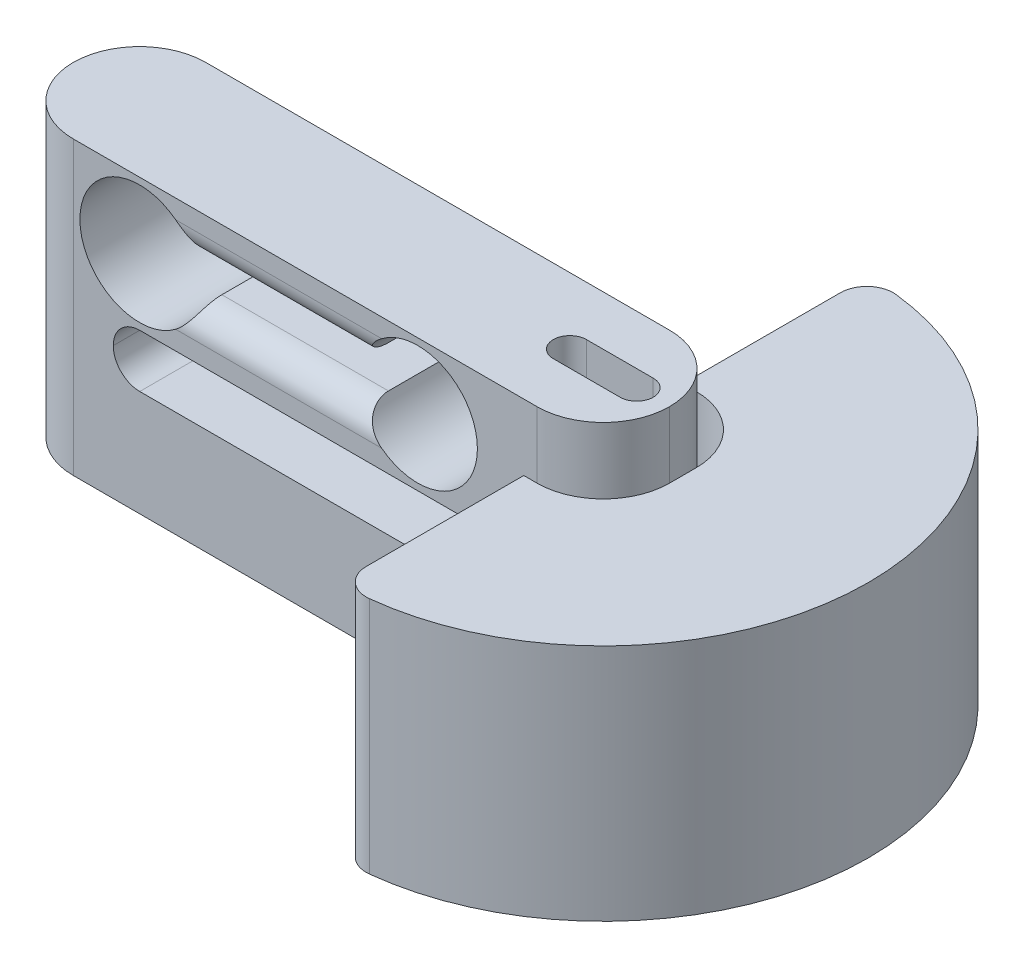
from build123d import *

# Parameters (mm, degrees)
BOSS_EXTRUDE1_DEPTH      = 5
BOSS_EXTRUDE1_DEPTH_BACK = 5
CUT_EXTRUDE1_DEPTH       = 5
BOSS_EXTRUDE2_START      = -14
SKETCH3_W                = 5.881583951
SKETCH3_H                = 10
BOSS_EXTRUDE2_DEPTH      = 8
BOSS_EXTRUDE3_START      = 10
BOSS_EXTRUDE3_DEPTH      = 10
FILLET2_R                = 5
FILLET3_R                = 2
SKETCH5_R                = 2
SKETCH5_W                = 3
SKETCH5_H                = 3
CUT_EXTRUDE2_DEPTH       = 4
FILLET4_R                = 1
SKETCH6_R                = 3.25
CUT_EXTRUDE3_DEPTH       = 5
BOSS_EXTRUDE4_START      = -14
SKETCH7_R                = 2
BOSS_EXTRUDE4_DEPTH      = 3.7
FILLET5_R                = 1.6


with BuildPart() as part:
    # Sketch1 → Boss-Extrude1 (new, two sides: drawn at the far end of the back side and taken through both)
    with BuildSketch(Plane.XY.offset(-BOSS_EXTRUDE1_DEPTH_BACK)):
        Polygon((5, -10), (5, 0), (0, 0), (-5, 0), (-35, 0), (-40, 0), (-40, -14), (-31.982625312, -14), (-31.982625312, -10), (-5, -10), align=None)
        with BuildLine():
            ThreePointArc((-25.78623506, -6.579298906), (-34.5, -5), (-25.78623506, -3.420701094))
            Line((-25.78623506, -3.420701094), (-13.21376494, -3.420701094))
            ThreePointArc((-13.21376494, -3.420701094), (-8.197485897, -0.572136959), (-4.5, -5))
            ThreePointArc((-4.5, -5), (-8.197485897, -9.427863041), (-13.21376494, -6.579298906))
            Line((-13.21376494, -6.579298906), (-25.78623506, -6.579298906))
        make_face(mode=Mode.SUBTRACT)
    extrude(amount=BOSS_EXTRUDE1_DEPTH + BOSS_EXTRUDE1_DEPTH_BACK)

    # Sketch2 → Cut-Extrude1 (cut)
    with BuildSketch(Plane(origin=(0, 0, 0), x_dir=(1, 0, 0), z_dir=(0, 1, 0))):
        with BuildLine():
            Line((-2.520975228, 1.25), (2.520975228, 1.25))
            ThreePointArc((2.520975228, 1.25), (3.770975228, 0), (2.520975228, -1.25))
            Line((2.520975228, -1.25), (-2.520975228, -1.25))
            ThreePointArc((-2.520975228, -1.25), (-3.770975228, 0), (-2.520975228, 1.25))
        make_face()
    extrude(amount=-CUT_EXTRUDE1_DEPTH, mode=Mode.SUBTRACT)

    # Sketch3 → Boss-Extrude2 (add)
    with BuildSketch(Plane(origin=(0, 0, 0), x_dir=(1, 0, 0), z_dir=(0, 1, 0)).offset(BOSS_EXTRUDE2_START)):
        with BuildLine():
            Line((0, 20), (0, 5))
            Line((0, 5), (5.881583951, 5))
            Line((5.881583951, 5), (5.881583951, -5))
            Line((5.881583951, -5), (0, -5))
            Line((0, -5), (0, -20))
            ThreePointArc((0, -20), (14.142135624, -14.142135624), (20, 0))
            ThreePointArc((20, 0), (14.142135624, 14.142135624), (0, 20))
        make_face()
        with Locations((2.940791976, 0)):
            Rectangle(SKETCH3_W, SKETCH3_H)
        with BuildLine():
            Line((0, 5), (-19.364916731, 5))
            ThreePointArc((-19.364916731, 5), (-20, 0), (-19.364916731, -5))
            Line((-19.364916731, -5), (0, -5))
            Line((0, -5), (0, 5))
        make_face()
        with BuildLine():
            Line((-19.364916731, 5), (-40, 5))
            Line((-40, 5), (-40, -5))
            Line((-40, -5), (-19.364916731, -5))
            ThreePointArc((-19.364916731, -5), (-20, 0), (-19.364916731, 5))
        make_face()
    extrude(amount=-BOSS_EXTRUDE2_DEPTH)

    # Sketch4 → Boss-Extrude3 (add)
    with BuildSketch(Plane(origin=(0, -14, 0), x_dir=(1, 0, 0), z_dir=(0, 1, 0)).offset(BOSS_EXTRUDE3_START)):
        with BuildLine():
            ThreePointArc((20, 0), (14.142135624, 14.142135624), (0, 20))
            Line((0, 20), (0, 6))
            Line((0, 6), (6, 6))
            Line((6, 6), (6, -6))
            Line((6, -6), (0, -6))
            Line((0, -6), (0, -20))
            ThreePointArc((0, -20), (14.142135624, -14.142135624), (20, 0))
        make_face()
    extrude(amount=-BOSS_EXTRUDE3_DEPTH)

    # Fillet2
    fillet2_edges = [part.edges().sort_by_distance(p)[0] for p in [
        (-40, -11, -5),
        (-40, -11, 5),
        (6, -9, 6),
        (6, -9, -6),
        (5, -5, 5),
        (5, -5, -5),
    ]]
    fillet(fillet2_edges, radius=FILLET2_R - 0.0001)  # a hair under: the kernel refuses the full size

    # Fillet3
    fillet3_edges = [part.edges().sort_by_distance(p)[0] for p in [
        (-19.5, -3.420701094, 5),
        (-19.5, -3.420701094, -5),
        (-19.5, -6.579298906, 5),
        (-19.5, -6.579298906, -5),
        (-31.982625312, -10, 0),
        (-31.982625312, -14, 0),
        (0, -13, -20),
        (0, -13, 20),
    ]]
    fillet(fillet3_edges, radius=FILLET3_R - 0.0001)  # a hair under: the kernel refuses the full size

    # Sketch5 → Cut-Extrude2 (cut)
    with BuildSketch(Plane.XZ.offset(22)):
        with Locations(Location((0, 0, 0), (0, 0, 270))):
            Circle(SKETCH5_R)
        with BuildLine():
            Line((-35, 3.25), (-12, 3.25))
            ThreePointArc((-12, 3.25), (-8.75, 0), (-12, -3.25))
            Line((-12, -3.25), (-35, -3.25))
            ThreePointArc((-35, -3.25), (-38.25, 0), (-35, 3.25))
        make_face()
        with Locations((-5, 0)):
            Rectangle(SKETCH5_W, SKETCH5_H)
        with Locations((5, 0)):
            Rectangle(SKETCH5_W, SKETCH5_H)
    extrude(amount=-CUT_EXTRUDE2_DEPTH, mode=Mode.SUBTRACT)

    # Fillet4
    fillet4_edges = [part.edges().sort_by_distance(p)[0] for p in [
        (-23.5, -18, 3.25),
        (-8.75, -18, 0),
        (-23.5, -18, -3.25),
        (-38.25, -18, 0),
        (0, -18, -5),
        (0, -18, 5),
        (0, -22, 2),
    ]]
    fillet(fillet4_edges, radius=FILLET4_R)

    # Sketch6 → Cut-Extrude3 (cut)
    with BuildSketch(Plane.XZ.offset(22)):
        with Locations(Location((-35, 0, 0), (0, 0, 270))):
            Circle(SKETCH6_R)
    extrude(amount=-CUT_EXTRUDE3_DEPTH, mode=Mode.SUBTRACT)

    # Sketch7 → Boss-Extrude4 (add)
    with BuildSketch(Plane(origin=(0, 0, 0), x_dir=(1, 0, 0), z_dir=(0, 1, 0)).offset(BOSS_EXTRUDE4_START)):
        with Locations(Location((0, 0, 0), (0, 0, 90))):
            Circle(SKETCH7_R)
    extrude(amount=BOSS_EXTRUDE4_DEPTH)

    # Fillet5
    fillet5_edges = [part.edges().sort_by_distance(p)[0] for p in [
        (0, -14, 2),
        (0, -10.3, 2),
    ]]
    fillet(fillet5_edges, radius=FILLET5_R)


solid = part.part
